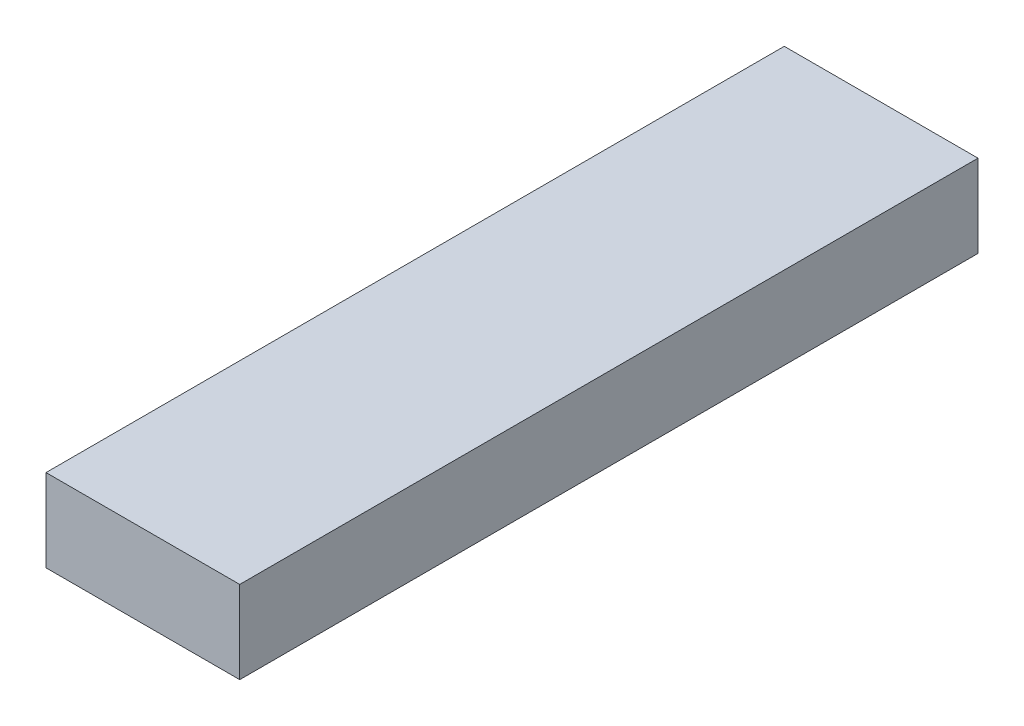
from build123d import *

# Parameters (mm, degrees)
SKIZZE1_W                       = 52.482326825
SKIZZE1_H                       = 22.353583648
AUFSATZ_LINEAR_AUSTRAGEN1_DEPTH = 200


with BuildPart() as part:
    # Skizze1 → Aufsatz-Linear austragen1 (new body)
    with BuildSketch(Plane.XY):
        with Locations((-162.31044063, 135.449774465)):
            Rectangle(SKIZZE1_W, SKIZZE1_H)
    extrude(amount=AUFSATZ_LINEAR_AUSTRAGEN1_DEPTH)


solid = part.part
